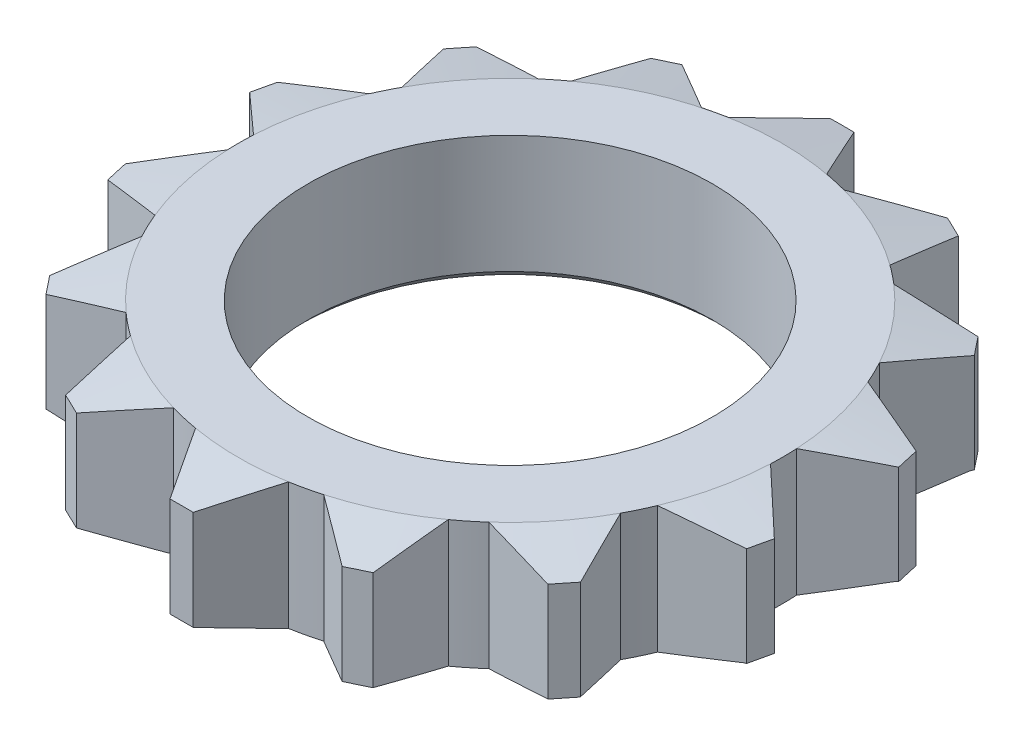
from build123d import *

# Parameters (mm, degrees)
BOSS_EXTRUDE1_DEPTH     = 7
CUT_EXTRUDE1_DEPTH      = 27.55666917
CUT_EXTRUDE1_DEPTH_BACK = 27.55666917
SKETCH2_R               = 11.15
CHAMFER1_SIZE           = 0.5


with BuildPart() as part:
    # Sketch1 → Boss-Extrude1 (new body)
    with BuildSketch(Plane(origin=(0, 0, 0), x_dir=(1, 0, 0), z_dir=(0, 1, 0))):
        with BuildLine():
            Line((-2.690008101, 14.770732174), (-3.939991899, 14.487482058))
            Line((-3.939991899, 14.487482058), (-7.321891345, 16.793222059))
            ThreePointArc((-7.321891345, 16.793222059), (-7.38270223, 16.766577104), (-7.443416154, 16.739711944))
            Line((-7.443416154, 16.739711944), (-8.446739742, 16.256536769))
            ThreePointArc((-8.446739742, 16.256536769), (-8.463901872, 16.247607981), (-8.481054563, 16.238661074))
            Line((-8.481054563, 16.238661074), (-8.786942019, 12.156876653))
            ThreePointArc((-8.786942019, 12.156876653), (-9.30157823, 11.767779843), (-9.799006656, 11.356912809))
            Line((-9.799006656, 11.356912809), (-13.843084255, 11.966459431))
            Line((-13.843084255, 11.966459431), (-14.642195381, 10.964405775))
            Line((-14.642195381, 10.964405775), (-13.162373474, 7.193881049))
            ThreePointArc((-13.162373474, 7.193881049), (-13.473376511, 6.593036129), (-13.75696946, 5.97877841))
            Line((-13.75696946, 5.97877841), (-17.619065059, 4.787479689))
            Line((-17.619065059, 4.787479689), (-17.904264518, 3.537939217))
            Line((-17.904264518, 3.537939217), (-14.977446595, 0.822249051))
            ThreePointArc((-14.977446595, 0.822249051), (-14.999626323, 0.105878122), (-14.987561621, -0.610734529))
            Line((-14.987561621, -0.610734529), (-17.906263635, -3.318894233))
            Line((-17.906263635, -3.318894233), (-17.621064177, -4.568434704))
            Line((-17.621064177, -4.568434704), (-13.863468127, -5.727499583))
            ThreePointArc((-13.863468127, -5.727499583), (-13.556568668, -6.420237219), (-13.215080515, -7.096594041))
            Line((-13.215080515, -7.096594041), (-14.647796784, -10.747095559))
            Line((-14.647796784, -10.747095559), (-13.848685659, -11.749149216))
            Line((-13.848685659, -11.749149216), (-10.010790112, -11.170679538))
            ThreePointArc((-10.010790112, -11.170679538), (-9.407751572, -11.683073669), (-8.778530079, -12.162952341))
            Line((-8.778530079, -12.162952341), (-8.489043827, -16.025877918))
            Line((-8.489043827, -16.025877918), (-7.334294794, -16.581975744))
            Line((-7.334294794, -16.581975744), (-4.153638705, -14.41344114))
            ThreePointArc((-4.153638705, -14.41344114), (-3.368562482, -14.616866518), (-2.57363918, -14.777563445))
            Line((-2.57363918, -14.777563445), (-0.64982132, -18.109713723))
            Line((-0.64982132, -18.109713723), (0.631853413, -18.109713723))
            Line((0.631853413, -18.109713723), (2.553671539, -14.781027084))
            ThreePointArc((2.553671539, -14.781027084), (3.350557549, -14.62100421), (4.137605806, -14.418051817))
            Line((4.137605806, -14.418051817), (7.317216578, -16.585873735))
            Line((7.317216578, -16.585873735), (8.471965611, -16.02977591))
            Line((8.471965611, -16.02977591), (8.760785708, -12.175739558))
            ThreePointArc((8.760785708, -12.175739558), (9.394619814, -11.693635814), (10.001974885, -11.178573183))
            Line((10.001974885, -11.178573183), (13.834100302, -11.756173154))
            Line((13.834100302, -11.756173154), (14.633211427, -10.754119497))
            Line((14.633211427, -10.754119497), (13.205053968, -7.115233637))
            ThreePointArc((13.205053968, -7.115233637), (13.550607783, -6.432808773), (13.860923325, -5.733655429))
            Line((13.860923325, -5.733655429), (17.610081105, -4.577193411))
            Line((17.610081105, -4.577193411), (17.895280564, -3.32765294))
            Line((17.895280564, -3.32765294), (14.986806848, -0.62898371))
            ThreePointArc((14.986806848, -0.62898371), (14.999694965, 0.095660601), (14.977565429, 0.820081587))
            Line((14.977565429, 0.820081587), (17.897279682, 3.52918051))
            Line((17.897279682, 3.52918051), (17.612080223, 4.778720982))
            Line((17.612080223, 4.778720982), (13.762438681, 5.966178135))
            ThreePointArc((13.762438681, 5.966178135), (13.476227073, 6.587207593), (13.162009189, 7.194547526))
            Line((13.162009189, 7.194547526), (14.63881283, 10.957381837))
            Line((14.63881283, 10.957381837), (13.839701705, 11.959435493))
            Line((13.839701705, 11.959435493), (9.805430549, 11.351366955))
            ThreePointArc((9.805430549, 11.351366955), (9.304302221, 11.765626213), (8.785692542, 12.157779673))
            Line((8.785692542, 12.157779673), (8.480059873, 16.236164196))
            Line((8.480059873, 16.236164196), (7.337140831, 16.786564998))
            ThreePointArc((7.337140831, 16.786564998), (7.330988726, 16.789252643), (7.324835637, 16.791938033))
            Line((7.324835637, 16.791938033), (3.939102207, 14.483584066))
            Line((3.939102207, 14.483584066), (3.603134532, 14.560818025))
            ThreePointArc((3.603134532, 14.560818025), (3.360619898, 14.618694672), (3.117176792, 14.672532462))
            Line((3.117176792, 14.672532462), (2.690008101, 14.770732174))
            Line((2.690008101, 14.770732174), (0.64744468, 18.308555797))
            ThreePointArc((0.64744468, 18.308555797), (0, 18.32), (-0.64744468, 18.308555797))
            Line((-0.64744468, 18.308555797), (-2.690008101, 14.770732174))
        make_face()
    extrude(amount=BOSS_EXTRUDE1_DEPTH)

    # Sketch2 → Cut-Extrude1 (cut, two sides: drawn at the far end of the back side and taken through both)
    with BuildSketch(Plane.XZ.offset(-CUT_EXTRUDE1_DEPTH_BACK)):
        Circle(SKETCH2_R)
    extrude(amount=CUT_EXTRUDE1_DEPTH + CUT_EXTRUDE1_DEPTH_BACK, mode=Mode.SUBTRACT)

    # Sketch3 → Cut-Revolve2 (revolve, cut)
    with BuildSketch(Plane(origin=(0, 0, 0), x_dir=(0, 0, -1), z_dir=(1, 0, 0))):
        Polygon((-15, 7), (-15, 7.5), (-18.609713723, 7.5), (-18.609713723, 6.129410121), align=None)
        Polygon((-15, 0), (-18.109713723, 0.75), (-18.609713723, 0.75), (-18.609713723, -0.5), (-15, -0.5), align=None)
    revolve(axis=Axis((0, 7, 0), (0, -1, 0)), mode=Mode.SUBTRACT)

    # Chamfer1
    chamfer1_edges = [part.edges().sort_by_distance(p)[0] for p in [
        (-11.15, 0, 0),
    ]]
    chamfer(chamfer1_edges, length=CHAMFER1_SIZE)


solid = part.part
